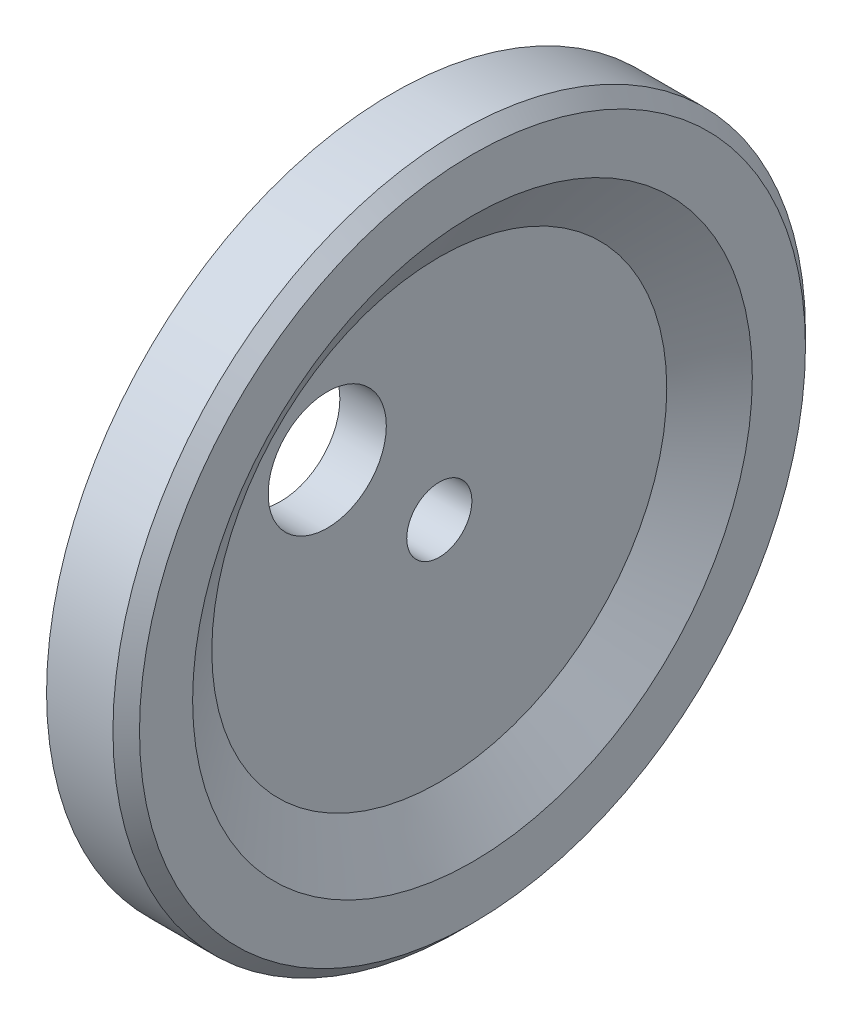
from build123d import *

# Parameters (mm, degrees)
CHAMFER1_SIZE      = 2
SKETCH3_R          = 8.9
CUT_EXTRUDE1_DEPTH = 10


with BuildPart() as part:
    # Sketch1 → Revolve1 (revolve)
    with BuildSketch(Plane(origin=(0, 0, 0), x_dir=(1, 0, 0), z_dir=(0, 1, 0))):
        Polygon((0, 4.9022), (0, 52.15), (12, 52.15), (12, 42.15), (7, 34.26), (7, 4.9022), align=None)
    revolve(axis=Axis((0, 0, 0), (1, 0, 0)))

    # Chamfer1
    chamfer1_edges = [part.edges().sort_by_distance(p)[0] for p in [
        (12, 0, 52.15),
    ]]
    chamfer(chamfer1_edges, length=CHAMFER1_SIZE)

    # Sketch3 → Cut-Extrude1 (cut)
    with BuildSketch(Plane(origin=(7, 0, 0), x_dir=(0, 0, -1), z_dir=(1, 0, 0))):
        with Locations((-16.875192026, 16.225331227)):
            Circle(SKETCH3_R)
    extrude(amount=-CUT_EXTRUDE1_DEPTH, mode=Mode.SUBTRACT)


solid = part.part
